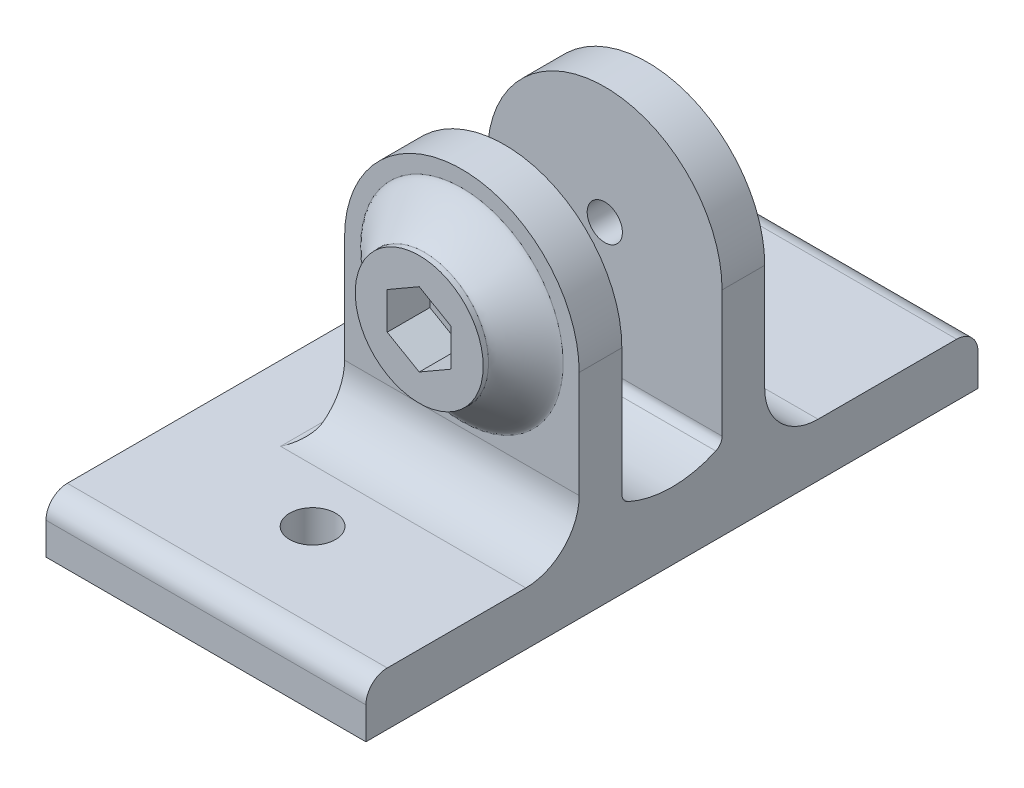
from build123d import *

# Parameters (mm, degrees)
SALIENTE_EXTRUIR1_START = 0.2
CROQUIS1_R              = 1.65
SALIENTE_EXTRUIR1_DEPTH = 4
CROQUIS2_W              = 30
CROQUIS2_H              = 5
SALIENTE_EXTRUIR2_DEPTH = 20
CROQUIS3_R              = 2.15
CORTAR_EXTRUIR1_DEPTH   = 41.282005908
CROQUIS4_W              = 30
CROQUIS4_H              = 5
SALIENTE_EXTRUIR3_DEPTH = 10
CROQUIS5_R              = 6
SALIENTE_EXTRUIR4_DEPTH = 4
CHAFL_N2_SIZE           = 2.5
CHAFL_N2_SIZE2          = 5
CHAFL_N3_SIZE           = 2.5
CHAFL_N3_SIZE_2         = 5
REDONDEO1_R             = 10
REDONDEO2_R             = 1
REDONDEO3_R             = 1
REDONDEO4_R             = 5
REDONDEO5_R             = 5
REDONDEO6_R             = 2
REDONDEO7_R             = 1
REDONDEO8_SIZE          = 3.5


with BuildPart() as part:
    # Croquis1 → Saliente-Extruir1 (new body)
    with BuildSketch(Plane.XY.offset(SALIENTE_EXTRUIR1_START)):
        with BuildLine():
            Line((11, 0), (11, -20))
            Line((11, -20), (-19, -20))
            Line((-19, -20), (-19, -15))
            Line((-19, -15), (-11, -15))
            Line((-11, -15), (-11, 0))
            ThreePointArc((-11, 0), (0, 11), (11, 0))
        make_face()
        Circle(CROQUIS1_R, mode=Mode.SUBTRACT)
    saliente_extruir1 = extrude(amount=SALIENTE_EXTRUIR1_DEPTH)

    # Croquis2 → Saliente-Extruir2 (add)
    with BuildSketch(Plane.XY.offset(4.2)):
        with Locations((-4, -17.5)):
            Rectangle(CROQUIS2_W, CROQUIS2_H)
    saliente_extruir2 = extrude(amount=SALIENTE_EXTRUIR2_DEPTH)

    # Croquis3 → Cortar-Extruir1 (cut, through all)
    with BuildSketch(Plane(origin=(0, -15, 0), x_dir=(1, 0, 0), z_dir=(0, 1, 0))):
        with Locations(Location((-4, -14.2, 0), (0, 0, 270))):
            Circle(CROQUIS3_R)
    cortar_extruir1 = extrude(amount=-CORTAR_EXTRUIR1_DEPTH, mode=Mode.SUBTRACT)

    # Croquis4 → Saliente-Extruir3 (add)
    with BuildSketch(Plane(origin=(0, 0, 0.2), x_dir=(-1, 0, 0), z_dir=(0, 0, -1))):
        with Locations((4, -17.5)):
            Rectangle(CROQUIS4_W, CROQUIS4_H)
    extrude(amount=SALIENTE_EXTRUIR3_DEPTH)

    # Simetría1: Saliente-Extruir1, Saliente-Extruir2, Cortar-Extruir1 across plane
    add(saliente_extruir1.mirror(Plane(origin=(0, 0, -4.5), x_dir=(1, 0, 0), z_dir=(0, 0, -1))))
    add(saliente_extruir2.mirror(Plane(origin=(0, 0, -4.5), x_dir=(1, 0, 0), z_dir=(0, 0, -1))))
    add(cortar_extruir1.mirror(Plane(origin=(0, 0, -4.5), x_dir=(1, 0, 0), z_dir=(0, 0, -1))), mode=Mode.SUBTRACT)

    # Croquis5 → Saliente-Extruir4 (add)
    with BuildSketch(Plane.XY.offset(4.2)):
        Circle(CROQUIS5_R)
        Polygon((3, -1.732050808), (3, 1.732050808), (0, 3.464101615), (-3, 1.732050808), (-3, -1.732050808), (0, -3.464101615), align=None, mode=Mode.SUBTRACT)
    extrude(amount=SALIENTE_EXTRUIR4_DEPTH)

    # Chaflán2
    chafl_n2_edges = [part.edges().sort_by_distance(p)[0] for p in [
        (0, -15, 0.2),
    ]]
    chafl_n2_side = [part.faces().sort_by_distance(p)[0] for p in [
        (0, -3.103861524, 0.2),
    ]]
    chamfer(chafl_n2_edges, length=CHAFL_N2_SIZE, length2=CHAFL_N2_SIZE2, reference=chafl_n2_side[0])

    # Chaflán3
    # the kernel refuses this chamfer: 5, 2.5 mm, written as the material it adds along each edge
    with BuildSketch(Plane(origin=(11, -15, -9.2), x_dir=(0, 1, 0), z_dir=(-1, 0, 0))) as chafl_n3_piece_1:
        Polygon((CHAFL_N3_SIZE, 0), (0, -CHAFL_N3_SIZE_2), (0, 0), align=None)
    extrude(amount=22)

    # Redondeo1
    redondeo1_edges = [part.edges().sort_by_distance(p)[0] for p in [
        (0, -14.85, -4.5),
    ]]
    fillet(redondeo1_edges, radius=REDONDEO1_R)

    # Redondeo2
    redondeo2_edges = [part.edges().sort_by_distance(p)[0] for p in [
        (0, -12.5, -9.2),
    ]]
    fillet(redondeo2_edges, radius=REDONDEO2_R)

    # Redondeo3
    redondeo3_edges = [part.edges().sort_by_distance(p)[0] for p in [
        (0, -12.5, 0.2),
    ]]
    fillet(redondeo3_edges, radius=REDONDEO3_R)

    # Redondeo4
    redondeo4_edges = [part.edges().sort_by_distance(p)[0] for p in [
        (0, -15, 4.2),
    ]]
    fillet(redondeo4_edges, radius=REDONDEO4_R)

    # Redondeo5
    redondeo5_edges = [part.edges().sort_by_distance(p)[0] for p in [
        (0, -15, -13.2),
    ]]
    fillet(redondeo5_edges, radius=REDONDEO5_R)

    # Redondeo6
    redondeo6_edges = [part.edges().sort_by_distance(p)[0] for p in [
        (-4, -15, 24.2),
        (-4, -15, -33.2),
    ]]
    fillet(redondeo6_edges, radius=REDONDEO6_R)

    # Redondeo7
    redondeo7_edges = [part.edges().sort_by_distance(p)[0] for p in [
        (-11, -15, -4.5),
        (-11, -15, -4.5),
    ]]
    fillet(redondeo7_edges, radius=REDONDEO7_R)

    # Redondeo8
    # a fillet whose section is not a circle: 3.5 mm, written as the material it adds along each edge
    with BuildSketch(Plane(origin=(0, 0, 4.2), x_dir=(1, 0, 0), z_dir=(0, -1, 0))) as redondeo8_piece_1:
        with BuildLine():
            Bezier((6, REDONDEO8_SIZE), (6, 0), (6 + REDONDEO8_SIZE, 0), weights=[1, 0.111111111, 1])
            Line((6 + REDONDEO8_SIZE, 0), (6, 0))
            Line((6, 0), (6, REDONDEO8_SIZE))
        make_face()
    revolve(axis=Axis((0, 0, 4.2), (0, 0, 1)))


solid = part.part
